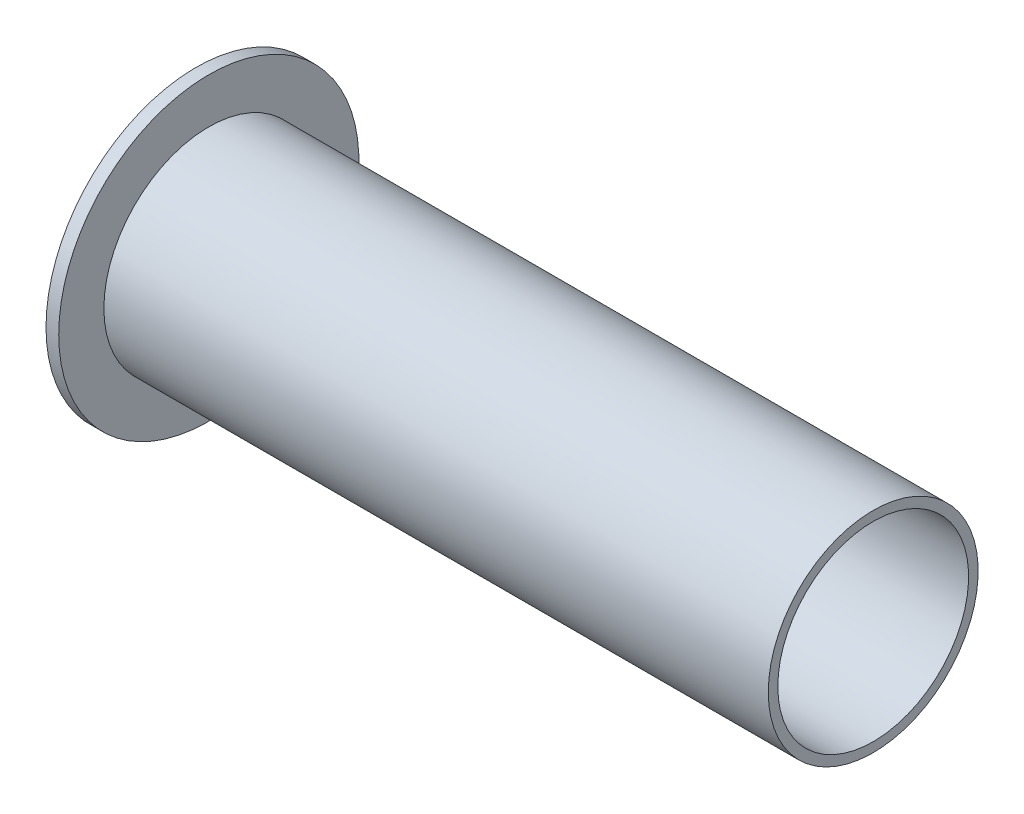
from build123d import *


with BuildPart() as part:
    # Esboço1 → Revolução2 (revolve)
    with BuildSketch(Plane.XY):
        Polygon((-51.961483519, 23.6), (-51.961483519, 16.5), (52.5, 16.5), (52.5, 15), (-53.961483519, 15), (-53.961483519, 23.6), align=None)
    revolve(axis=Axis((-52.5, 0, 0), (1, 0, 0)))


solid = part.part
